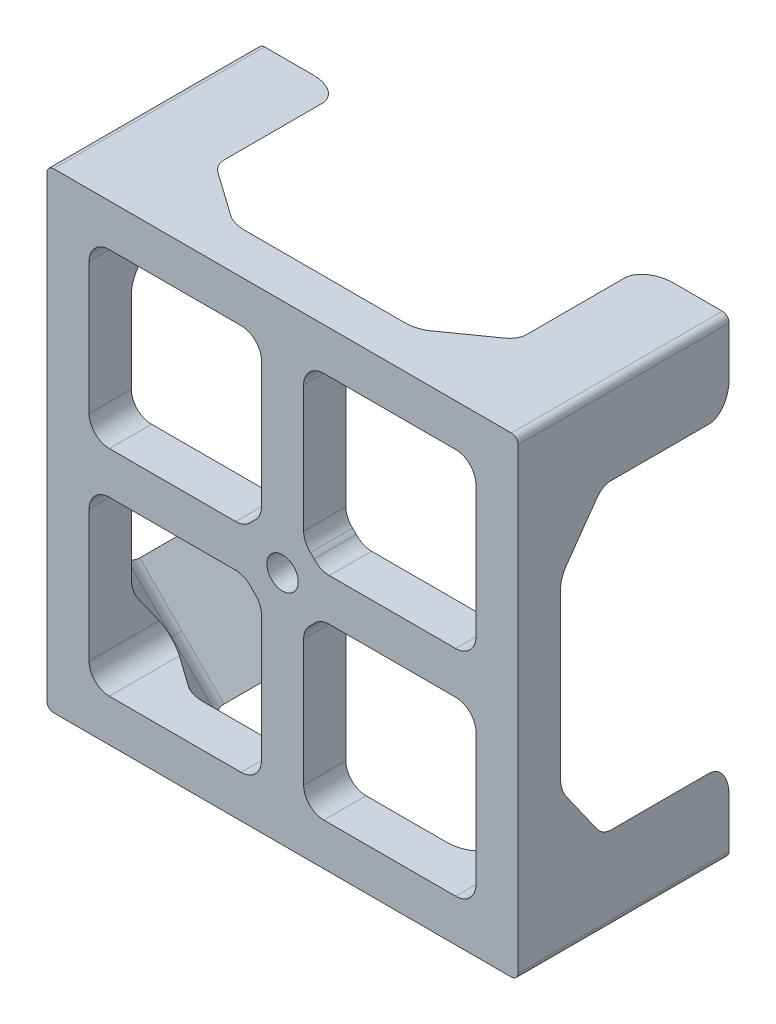
from build123d import *

# Parameters (mm, degrees)
BOSS_EXTRUDE1_DEPTH          = 6.35
BOSS_EXTRUDE1_2_DEPTH        = 6.35
BOSS_EXTRUDE1_3_DEPTH        = 6.35
BOSS_EXTRUDE1_4_DEPTH        = 6.35
EXTRUDE_THIN1_DEPTH          = 1.5875
SKETCH2_3_W                  = 17.7292
SKETCH2_3_H                  = 17.7292
SKETCH2_3_W_2                = 14.5542
SKETCH2_3_H_2                = 14.5542
EXTRUDE_THIN2_DEPTH          = 1.5875
SKETCH6_R                    = 1.5875
BOSS_EXTRUDE3_DEPTH          = 1.5875
F_56_0_0465_DIAMETER_HOLE1_D = 1.1811
CHAMFER1_SIZE                = 1.5875
FILLET2_R                    = 0.762
FILLET3_R                    = 0.762
FILLET4_R                    = 0.254


# Read off the part's stored shape, not the designer's step: Extrude-Thin1
with BuildPart() as part:
    # Sketch1 → Boss-Extrude1 (new body)
    with BuildSketch(Plane.XY):
        Polygon((-97.6376, 73.8886), (-94.4626, 73.8886), (-97.6376, 70.7136), align=None)
    extrude(amount=BOSS_EXTRUDE1_DEPTH)



with BuildPart() as body_2:
    # Sketch1 → Boss-Extrude1 2 (new body)
    with BuildSketch(Plane.XY):
        Polygon((-79.9084, 70.7136), (-79.9084, 73.8886), (-83.0834, 73.8886), align=None)
    extrude(amount=BOSS_EXTRUDE1_2_DEPTH)


with BuildPart() as body_3:
    # Sketch1 → Boss-Extrude1 3 (new body)
    with BuildSketch(Plane.XY):
        Polygon((-79.9084, 56.1594), (-83.0834, 56.1594), (-79.9084, 59.3344), align=None)
    extrude(amount=BOSS_EXTRUDE1_3_DEPTH)


with BuildPart() as body_4:
    # Sketch1 → Boss-Extrude1 4 (new body)
    with BuildSketch(Plane.XY):
        Polygon((-97.6376, 59.3344), (-97.6376, 56.1594), (-94.4626, 56.1594), align=None)
    extrude(amount=BOSS_EXTRUDE1_4_DEPTH)


with BuildPart() as body_5:
    # Extrude-Thin1 outline → Extrude-Thin1 (new body)
    with BuildSketch(Plane.XY.offset(6.35)):
        Polygon((-89.56675, 65.81775), (-97.6376, 65.81775), (-97.6376, 64.23025), (-89.56675, 64.23025), (-89.56675, 56.1594), (-87.97925, 56.1594), (-87.97925, 64.23025), (-79.9084, 64.23025), (-79.9084, 65.81775), (-87.97925, 65.81775), (-87.97925, 73.8886), (-89.56675, 73.8886), align=None)
    extrude(amount=EXTRUDE_THIN1_DEPTH)


with BuildPart() as part_1:
    add(part.part)

    add(body_2.part)  # Extrude-Thin2 merges body 2

    add(body_3.part)  # Extrude-Thin2 merges body 3

    add(body_4.part)  # Extrude-Thin2 merges body 4

    add(body_5.part)  # Extrude-Thin2 merges body 5
    # Sketch2<3> → Extrude-Thin2 (add)
    with BuildSketch(Plane.XY.offset(6.35)):
        with Locations((-88.773, 65.024)):
            Rectangle(SKETCH2_3_W, SKETCH2_3_H)
        with Locations((-88.773, 65.024)):
            Rectangle(SKETCH2_3_W_2, SKETCH2_3_H_2, mode=Mode.SUBTRACT)
    extrude(amount=EXTRUDE_THIN2_DEPTH)

    # Sketch6 → Boss-Extrude3 (add)
    with BuildSketch(Plane.XY.offset(7.9375)):
        with Locations((-88.773, 65.024)):
            Circle(SKETCH6_R)
    extrude(amount=-BOSS_EXTRUDE3_DEPTH)

    # #56 (0.0465) Diameter Hole1 (through all)
    with Locations(Plane.XY.offset(7.9375)):
        with Locations((-88.773, 65.024)):
            Hole(F_56_0_0465_DIAMETER_HOLE1_D / 2)

    # Chamfer1
    # the kernel refuses this chamfer: 1.5875 mm, written as the material it adds along each edge
    with BuildSketch(Plane(origin=(-85.970196487, 53.272603513, 6.35), x_dir=(-0.7068394360706735, 0.7068394360706735, 0.02749587661058616), z_dir=(0.7071067811865476, 0.7071067811865476, 0))) as chamfer1_piece_1_section:
        Polygon((CHAMFER1_SIZE * 0.999621916911, -CHAMFER1_SIZE * 0.0274958766106), (-CHAMFER1_SIZE * 0.0274958766106, -CHAMFER1_SIZE * 0.999621916911), (0, 0), align=None)
    chamfer1_piece_1 = extrude(amount=6.327610774, mode=Mode.PRIVATE)
    chamfer1_piece_1 = split(chamfer1_piece_1, bisect_by=Plane(origin=(-83.03148044, 56.1594, 5.826998953), z_dir=(0, 1, 0)), keep=Keep.TOP, mode=Mode.PRIVATE)
    chamfer1_piece_1 = split(chamfer1_piece_1, bisect_by=Plane(origin=(-83.03148044, 57.7469, 5.826998953), z_dir=(0, -1, 0)), keep=Keep.TOP, mode=Mode.PRIVATE)
    add(chamfer1_piece_1)
    with BuildSketch(Plane(origin=(-81.4959, 57.7469, 6.35), x_dir=(-0.7068394360706735, 0.7068394360706735, 0.02749587661058616), z_dir=(0.7071067811865476, 0.7071067811865476, 0))) as chamfer1_piece_2_section:
        Polygon((CHAMFER1_SIZE * 0.999621916911, -CHAMFER1_SIZE * 0.0274958766106), (-CHAMFER1_SIZE * 0.0274958766106, -CHAMFER1_SIZE * 0.999621916911), (0, 0), align=None)
    chamfer1_piece_2 = extrude(amount=6.327610774, mode=Mode.PRIVATE)
    chamfer1_piece_2 = split(chamfer1_piece_2, bisect_by=Plane(origin=(-79.9084, 59.28248044, 5.826998953), z_dir=(-1, 0, 0)), keep=Keep.TOP, mode=Mode.PRIVATE)
    chamfer1_piece_2 = split(chamfer1_piece_2, bisect_by=Plane(origin=(-81.4959, 59.28248044, 5.826998953), z_dir=(1, 0, 0)), keep=Keep.TOP, mode=Mode.PRIVATE)
    add(chamfer1_piece_2)
    with BuildSketch(Plane(origin=(-81.4959, 72.3011, 6.35), x_dir=(0.01944252080601567, 0.01944252080601567, -0.9996219169112966), z_dir=(0.7071067811865476, -0.7071067811865476, 0))) as chamfer1_piece_3_section:
        Polygon((CHAMFER1_SIZE * 0.999621916911, -CHAMFER1_SIZE * 0.0274958766106), (-CHAMFER1_SIZE * 0.0274958766106, -CHAMFER1_SIZE * 0.999621916911), (0, 0), align=None)
    chamfer1_piece_3 = extrude(amount=6.327610774, mode=Mode.PRIVATE)
    chamfer1_piece_3 = split(chamfer1_piece_3, bisect_by=Plane(origin=(-79.9084, 72.313041711, 5.228115698), z_dir=(-1, 0, 0)), keep=Keep.TOP, mode=Mode.PRIVATE)
    chamfer1_piece_3 = split(chamfer1_piece_3, bisect_by=Plane(origin=(-81.4959, 72.313041711, 5.228115698), z_dir=(1, 0, 0)), keep=Keep.TOP, mode=Mode.PRIVATE)
    add(chamfer1_piece_3)
    with BuildSketch(Plane(origin=(-85.970196487, 76.775396487, 6.35), x_dir=(0.01944252080601567, 0.01944252080601567, -0.9996219169112966), z_dir=(0.7071067811865476, -0.7071067811865476, 0))) as chamfer1_piece_4_section:
        Polygon((CHAMFER1_SIZE * 0.999621916911, -CHAMFER1_SIZE * 0.0274958766106), (-CHAMFER1_SIZE * 0.0274958766106, -CHAMFER1_SIZE * 0.999621916911), (0, 0), align=None)
    chamfer1_piece_4 = extrude(amount=6.327610774, mode=Mode.PRIVATE)
    chamfer1_piece_4 = split(chamfer1_piece_4, bisect_by=Plane(origin=(-83.03148044, 73.8886, 5.826998953), z_dir=(0, -1, 0)), keep=Keep.TOP, mode=Mode.PRIVATE)
    chamfer1_piece_4 = split(chamfer1_piece_4, bisect_by=Plane(origin=(-83.03148044, 72.3011, 5.826998953), z_dir=(0, 1, 0)), keep=Keep.TOP, mode=Mode.PRIVATE)
    add(chamfer1_piece_4)
    with BuildSketch(Plane(origin=(-91.575803513, 76.775396487, 6.35), x_dir=(0.7068394360706735, -0.7068394360706735, 0.02749587661058616), z_dir=(-0.7071067811865476, -0.7071067811865476, 0))) as chamfer1_piece_5_section:
        Polygon((CHAMFER1_SIZE * 0.999621916911, -CHAMFER1_SIZE * 0.0274958766106), (-CHAMFER1_SIZE * 0.0274958766106, -CHAMFER1_SIZE * 0.999621916911), (0, 0), align=None)
    chamfer1_piece_5 = extrude(amount=6.327610774, mode=Mode.PRIVATE)
    chamfer1_piece_5 = split(chamfer1_piece_5, bisect_by=Plane(origin=(-94.51451956, 73.8886, 5.826998953), z_dir=(0, -1, 0)), keep=Keep.TOP, mode=Mode.PRIVATE)
    chamfer1_piece_5 = split(chamfer1_piece_5, bisect_by=Plane(origin=(-94.51451956, 72.3011, 5.826998953), z_dir=(0, 1, 0)), keep=Keep.TOP, mode=Mode.PRIVATE)
    add(chamfer1_piece_5)
    with BuildSketch(Plane(origin=(-96.0501, 72.3011, 6.35), x_dir=(0.7068394360706735, -0.7068394360706735, 0.02749587661058616), z_dir=(-0.7071067811865476, -0.7071067811865476, 0))) as chamfer1_piece_6_section:
        Polygon((CHAMFER1_SIZE * 0.999621916911, -CHAMFER1_SIZE * 0.0274958766106), (-CHAMFER1_SIZE * 0.0274958766106, -CHAMFER1_SIZE * 0.999621916911), (0, 0), align=None)
    chamfer1_piece_6 = extrude(amount=6.327610774, mode=Mode.PRIVATE)
    chamfer1_piece_6 = split(chamfer1_piece_6, bisect_by=Plane(origin=(-97.6376, 70.76551956, 5.826998953), z_dir=(1, 0, 0)), keep=Keep.TOP, mode=Mode.PRIVATE)
    chamfer1_piece_6 = split(chamfer1_piece_6, bisect_by=Plane(origin=(-96.0501, 70.76551956, 5.826998953), z_dir=(-1, 0, 0)), keep=Keep.TOP, mode=Mode.PRIVATE)
    add(chamfer1_piece_6)
    with BuildSketch(Plane(origin=(-91.575803513, 53.272603513, 6.35), x_dir=(0.7068394360706735, 0.7068394360706735, 0.027495876610586705), z_dir=(-0.7071067811865476, 0.7071067811865476, 0))) as chamfer1_piece_7_section:
        Polygon((CHAMFER1_SIZE * 0.999621916911, CHAMFER1_SIZE * 0.0274958766106), (-CHAMFER1_SIZE * 0.0274958766106, CHAMFER1_SIZE * 0.999621916911), (0, 0), align=None)
    chamfer1_piece_7 = extrude(amount=6.327610774, mode=Mode.PRIVATE)
    chamfer1_piece_7 = split(chamfer1_piece_7, bisect_by=Plane(origin=(-94.51451956, 56.1594, 5.826998953), z_dir=(0, 1, 0)), keep=Keep.TOP, mode=Mode.PRIVATE)
    chamfer1_piece_7 = split(chamfer1_piece_7, bisect_by=Plane(origin=(-94.51451956, 57.7469, 5.826998953), z_dir=(0, -1, 0)), keep=Keep.TOP, mode=Mode.PRIVATE)
    add(chamfer1_piece_7)
    with BuildSketch(Plane(origin=(-96.0501, 57.7469, 6.35), x_dir=(0.7068394360706735, 0.7068394360706735, 0.02749587661058616), z_dir=(-0.7071067811865476, 0.7071067811865476, 0))) as chamfer1_piece_8_section:
        Polygon((CHAMFER1_SIZE * 0.999621916911, CHAMFER1_SIZE * 0.0274958766106), (-CHAMFER1_SIZE * 0.0274958766106, CHAMFER1_SIZE * 0.999621916911), (0, 0), align=None)
    chamfer1_piece_8 = extrude(amount=6.327610774, mode=Mode.PRIVATE)
    chamfer1_piece_8 = split(chamfer1_piece_8, bisect_by=Plane(origin=(-97.6376, 59.28248044, 5.826998953), z_dir=(1, 0, 0)), keep=Keep.TOP, mode=Mode.PRIVATE)
    chamfer1_piece_8 = split(chamfer1_piece_8, bisect_by=Plane(origin=(-96.0501, 59.28248044, 5.826998953), z_dir=(-1, 0, 0)), keep=Keep.TOP, mode=Mode.PRIVATE)
    add(chamfer1_piece_8)

    # Fillet2
    # the kernel refuses this fillet: 0.762 mm, written as the material it adds along each edge
    with BuildSketch(Plane(origin=(-90.147815329, 64.23025, 6.35), x_dir=(-1, 0, 0), z_dir=(0, 0, 1)), Plane(origin=(-89.56675, 66.398815329, 6.35), x_dir=(0, 1, 0), z_dir=(0, 0, 1)), Plane(origin=(-87.97925, 63.649184671, 6.35), x_dir=(0, -1, 0), z_dir=(0, 0, 1)), Plane(origin=(-87.398184671, 65.81775, 6.35), x_dir=(1, 0, 0), z_dir=(0, 0, 1))) as fillet2_piece_1:
        with BuildLine():
            CenterArc((0.385807342, 0.762), FILLET2_R, 221.464980775, 48.535019225)
            ThreePointArc((-0.185205416, 0.257432432), (-0.086158249, 0.133352573), (0, 0))
            Line((0, 0), (0.385807342, 0))
        make_face()
    extrude(amount=1.5875)
    with BuildSketch(Plane(origin=(-90.147815329, 65.81775, 6.35), x_dir=(0.5840016210353491, 0.8117524909897625, 0), z_dir=(0, 0, 1)), Plane(origin=(-87.398184671, 64.23025, 6.35), x_dir=(-0.5840016210353066, -0.8117524909897931, 0), z_dir=(0, 0, 1)), Plane(origin=(-89.56675, 63.649184671, 6.35), x_dir=(-0.8117524909898051, 0.5840016210352901, 0), z_dir=(0, 0, 1)), Plane(origin=(-87.97925, 66.398815329, 6.35), x_dir=(0.811752490989754, -0.584001621035361, 0), z_dir=(0, 0, 1))) as fillet2_piece_2:
        with BuildLine():
            CenterArc((0.393243285, 0.758189306), FILLET2_R, 215.732490387, 48.535019225)
            Line((-0.225312113, 0.313180071), (0, 0))
            ThreePointArc((0, 0), (0.158565841, 0.007938946), (0.317131681, 0))
        make_face()
    extrude(amount=1.5875)
    with BuildSketch(Plane(origin=(-96.0501, 72.3011, 2.8575), x_dir=(1, 0, 0), z_dir=(0, 0, 1))) as fillet2_piece_3_section:
        with BuildLine():
            CenterArc((FILLET2_R, -FILLET2_R), FILLET2_R, 90, 90)
            Line((0, -FILLET2_R), (0, 0))
            Line((0, 0), (FILLET2_R, 0))
        make_face()
    fillet2_piece_3 = extrude(amount=5.08, mode=Mode.PRIVATE)
    fillet2_piece_3 = split(fillet2_piece_3, bisect_by=Plane(origin=(-95.361447412, 71.612447412, 5.73640183), z_dir=(-0.5000000000001895, 0.5000000000001895, 0.7071067811862797)), keep=Keep.TOP, mode=Mode.PRIVATE)
    add(fillet2_piece_3)
    with BuildSketch(Plane(origin=(-96.0501, 57.7469, 7.9375), x_dir=(0, 1, 0), z_dir=(0, 0, -1))) as fillet2_piece_4_section:
        with BuildLine():
            CenterArc((FILLET2_R, FILLET2_R), FILLET2_R, 180, 90)
            Line((0, FILLET2_R), (0, 0))
            Line((0, 0), (FILLET2_R, 0))
        make_face()
    fillet2_piece_4 = extrude(amount=5.08, mode=Mode.PRIVATE)
    fillet2_piece_4 = split(fillet2_piece_4, bisect_by=Plane(origin=(-95.361447412, 58.435552588, 5.73640183), z_dir=(-0.5000000000001895, -0.5000000000001895, 0.7071067811862797)), keep=Keep.TOP, mode=Mode.PRIVATE)
    add(fillet2_piece_4)
    with BuildSketch(Plane(origin=(-81.4959, 57.7469, 2.8575), x_dir=(-1, 0, 0), z_dir=(0, 0, 1))) as fillet2_piece_5_section:
        with BuildLine():
            CenterArc((FILLET2_R, -FILLET2_R), FILLET2_R, 90, 90)
            Line((0, -FILLET2_R), (0, 0))
            Line((0, 0), (FILLET2_R, 0))
        make_face()
    fillet2_piece_5 = extrude(amount=5.08, mode=Mode.PRIVATE)
    fillet2_piece_5 = split(fillet2_piece_5, bisect_by=Plane(origin=(-82.184552588, 58.435552588, 5.73640183), z_dir=(0.5000000000001895, -0.5000000000001895, 0.7071067811862797)), keep=Keep.TOP, mode=Mode.PRIVATE)
    add(fillet2_piece_5)
    with BuildSketch(Plane(origin=(-81.4959, 72.3011, 2.8575), x_dir=(0, -1, 0), z_dir=(0, 0, 1))) as fillet2_piece_6_section:
        with BuildLine():
            CenterArc((FILLET2_R, -FILLET2_R), FILLET2_R, 90, 90)
            Line((0, -FILLET2_R), (0, 0))
            Line((0, 0), (FILLET2_R, 0))
        make_face()
    fillet2_piece_6 = extrude(amount=5.08, mode=Mode.PRIVATE)
    fillet2_piece_6 = split(fillet2_piece_6, bisect_by=Plane(origin=(-82.184552588, 71.612447412, 5.73640183), z_dir=(0.500000000000017, 0.500000000000017, 0.7071067811865237)), keep=Keep.TOP, mode=Mode.PRIVATE)
    add(fillet2_piece_6)
    with BuildSketch(Plane(origin=(-81.4959, 64.23025, 7.9375), x_dir=(0, -1, 0), z_dir=(0, 0, -1)), Plane(origin=(-81.4959, 65.81775, 6.35), x_dir=(0, 1, 0), z_dir=(0, 0, 1)), Plane(origin=(-87.97925, 57.7469, 6.35), x_dir=(1, 0, 0), z_dir=(0, 0, 1)), Plane(origin=(-96.0501, 64.23025, 6.35), x_dir=(0, -1, 0), z_dir=(0, 0, 1)), Plane(origin=(-87.97925, 72.3011, 7.9375), x_dir=(1, 0, 0), z_dir=(0, 0, -1))) as fillet2_piece_7:
        with BuildLine():
            CenterArc((FILLET2_R, FILLET2_R), FILLET2_R, 180, 90)
            Line((0, FILLET2_R), (0, 0))
            Line((0, 0), (FILLET2_R, 0))
        make_face()
    extrude(amount=1.5875)
    with BuildSketch(Plane(origin=(-89.56675, 57.7469, 7.9375), x_dir=(0, 1, 0), z_dir=(0, 0, -1)), Plane(origin=(-96.0501, 65.81775, 7.9375), x_dir=(1, 0, 0), z_dir=(0, 0, -1)), Plane(origin=(-89.56675, 72.3011, 6.35), x_dir=(0, -1, 0), z_dir=(0, 0, 1))) as fillet2_piece_8:
        with BuildLine():
            CenterArc((FILLET2_R, -FILLET2_R), FILLET2_R, 90, 90)
            Line((0, -FILLET2_R), (0, 0))
            Line((0, 0), (FILLET2_R, 0))
        make_face()
    extrude(amount=1.5875)

    # Fillet3
    fillet3_edges = [part_1.edges().sort_by_distance(p)[0] for p in [
        (-96.84385, 60.78571403, 6.35),
        (-93.01128597, 56.95315, 6.35),
        (-96.84385, 69.26228597, 6.35),
        (-93.01128597, 73.09485, 6.35),
        (-84.53471403, 73.09485, 6.35),
        (-80.70215, 69.26228597, 6.35),
        (-80.70215, 60.78571403, 6.35),
        (-84.53471403, 56.95315, 6.35),
        (-81.4959, 57.7469, 4.7625),
        (-81.4959, 57.7469, 4.7625),
        (-81.4959, 72.3011, 4.7625),
        (-81.4959, 72.3011, 4.7625),
        (-96.0501, 72.3011, 4.7625),
        (-96.0501, 72.3011, 4.7625),
        (-96.0501, 57.7469, 4.7625),
        (-96.0501, 57.7469, 4.7625),
        (-81.4959, 72.3011, 0),
        (-81.4959, 57.7469, 0),
        (-96.0501, 72.3011, 0),
        (-96.0501, 57.7469, 0),
    ]]
    fillet(fillet3_edges, radius=FILLET3_R)

    # Fillet4
    fillet4_edges = [part_1.edges().sort_by_distance(p)[0] for p in [
        (-79.9084, 73.8886, 3.96875),
        (-97.6376, 56.1594, 3.96875),
        (-79.9084, 56.1594, 3.96875),
        (-97.6376, 73.8886, 3.96875),
    ]]
    fillet(fillet4_edges, radius=FILLET4_R)


solid = part_1.part
